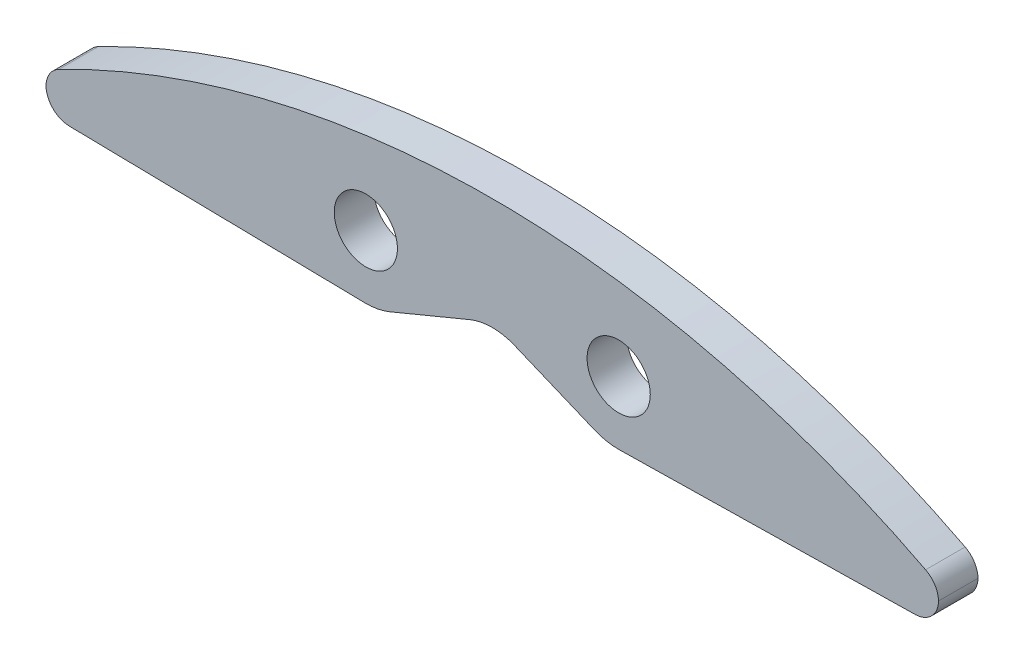
from build123d import *

# Parameters (mm, degrees)
SKETCH1_R           = 4
BOSS_EXTRUDE2_DEPTH = 5
FILLET3_R           = 3


with BuildPart() as part:
    # Sketch1 → Boss-Extrude2 (new body)
    with BuildSketch(Plane.XY):
        with BuildLine():
            ThreePointArc((-2.823470485, 6.805503827), (0, 7.367962264), (2.823470485, 6.805503827))
            Line((2.823470485, 6.805503827), (12.934326877, 2.610707185))
            ThreePointArc((12.934326877, 2.610707185), (14.507189087, 2.140514293), (16.142912091, 2.001276593))
            Line((16.142912091, 2.001276593), (56.478756137, 2.721951573))
            Line((56.478756137, 2.721951573), (56.478756137, 7.377996322))
            ThreePointArc((56.478756137, 7.377996322), (0, 21.5), (-56.478756137, 7.377996322))
            Line((-56.478756137, 7.377996322), (-56.478756137, 2.721951573))
            Line((-56.478756137, 2.721951573), (-16.142912091, 2.001276593))
            ThreePointArc((-16.142912091, 2.001276593), (-14.507189087, 2.140514293), (-12.934326877, 2.610707185))
            Line((-12.934326877, 2.610707185), (-2.823470485, 6.805503827))
        make_face()
        with Locations((-16, 10)):
            Circle(SKETCH1_R, mode=Mode.SUBTRACT)
        with Locations((16, 10)):
            Circle(SKETCH1_R, mode=Mode.SUBTRACT)
    extrude(amount=BOSS_EXTRUDE2_DEPTH)

    # Fillet3
    # the kernel refuses this fillet: 3 mm, written as the material it takes off along each edge
    with BuildSketch(Plane(origin=(56.478756137, 2.721951573, -7.367195529), x_dir=(-0.9998404258161971, -0.017864011410817362, 0), z_dir=(0, 0, 1)), Plane(origin=(-56.478756137, 2.721951573, -7.367195529), x_dir=(0, 1, 0), z_dir=(0, 0, 1))) as fillet3_piece_1:
        with BuildLine():
            CenterArc((FILLET3_R * 0.982292737151, -FILLET3_R), FILLET3_R, 90, 88.976413094)
            Line((-FILLET3_R * 0.0175476886652, -FILLET3_R * 0.982135988589), (0, 0))
            Line((0, 0), (FILLET3_R * 0.982292737151, 0))
        make_face()
    extrude(amount=19.734391057, mode=Mode.SUBTRACT)
    with BuildSketch(Plane(origin=(56.478756137, 7.377996322, -4.596333569), x_dir=(0, -1, 0), z_dir=(0, 0, 1))) as fillet3_piece_2:
        with BuildLine():
            CenterArc((1.8154063, -3), FILLET3_R, 90, 62.800936738)
            ThreePointArc((-0.852865239, -1.628749843), (-0.429551947, -0.812741542), (0, 0))
            Line((0, 0), (1.8154063, 0))
        make_face()
    extrude(amount=14.192667139, mode=Mode.SUBTRACT)
    with BuildSketch(Plane(origin=(-56.478756137, 7.377996322, -4.596333569), x_dir=(0, -1, 0), z_dir=(0, 0, 1))) as fillet3_piece_3:
        with BuildLine():
            CenterArc((1.8154063, 3), FILLET3_R, 207.199063262, 62.800936738)
            ThreePointArc((-0.852865239, 1.628749843), (-0.429551947, 0.812741542), (0, 0))
            Line((0, 0), (1.8154063, 0))
        make_face()
    extrude(amount=14.192667139, mode=Mode.SUBTRACT)


solid = part.part
